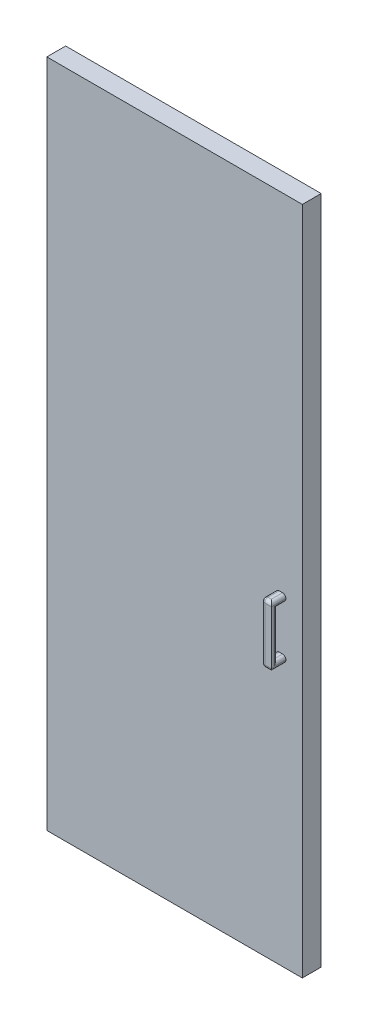
from build123d import *

# Parameters (mm, degrees)
BOSS_EXTRUDE2_DEPTH = 57.15
BOSS_EXTRUDE3_DEPTH = 44
CUT_EXTRUDE1_DEPTH  = 44
FILLET1_R           = 10
SKETCH6_W           = 120
SKETCH6_H           = 460.0000000000001
BOSS_EXTRUDE4_DEPTH = 10


with BuildPart() as part:
    # Sketch1 → Boss-Extrude2 (new body)
    with BuildSketch(Plane.XY):
        Polygon((0, 0), (0, 446.2018372120283), (-775, 446.2018372120282), (-774.9999999999995, -1585.7981627879717), (0, -1585.7981627879717), align=None)
    extrude(amount=BOSS_EXTRUDE2_DEPTH)

    # Sketch4 → Boss-Extrude3 (add)
    with BuildSketch(Plane.XY.offset(57.15)):
        Polygon((-79.99999999999993, -603.7981627879718), (-49.999999999999936, -603.7981627879718), (-49.999999999999915, -785.7981627879718), (-79.9999999999999, -785.7981627879718), align=None)
    extrude(amount=BOSS_EXTRUDE3_DEPTH)

    # Sketch5 → Cut-Extrude1 (cut)
    with BuildSketch(Plane.ZY.offset(80.00000000000003)):
        Polygon((83.14999999999999, -624.7981627879717), (57.150000000000006, -624.7981627879717), (57.15, -764.7981627879717), (83.15, -764.7981627879717), align=None)
    extrude(amount=-CUT_EXTRUDE1_DEPTH, mode=Mode.SUBTRACT)

    # Fillet1
    # the kernel refuses this fillet: 10 mm, written as the material it takes off along each edge
    with BuildSketch(Plane(origin=(-69.99999999999993, -613.7981627879718, 91.15), x_dir=(-1, -1.6e-16, 0), z_dir=(0, 1, 0))) as fillet1_piece_1_section:
        Polygon((0, 0), (FILLET1_R, 0), (FILLET1_R, FILLET1_R), (0, FILLET1_R), align=None)
    fillet1_piece_1 = extrude(amount=FILLET1_R, mode=Mode.PRIVATE)
    fillet1_piece_1 = fillet1_piece_1 - Plane(origin=(-69.99999999999993, -613.7981627879718, 91.15), x_dir=(0.7071067811865475, 0, -0.7071067811865475), z_dir=(0, 1, 0)) * Sphere(FILLET1_R, mode=Mode.PRIVATE)
    add(fillet1_piece_1, mode=Mode.SUBTRACT)
    with BuildSketch(Plane(origin=(-69.9999999999999, -775.7981627879718, 91.15), x_dir=(0, 0, 1), z_dir=(-1, -1.6e-16, 0))) as fillet1_piece_2_section:
        Polygon((0, 0), (FILLET1_R, 0), (FILLET1_R, -FILLET1_R), (0, -FILLET1_R), align=None)
    fillet1_piece_2 = extrude(amount=FILLET1_R, mode=Mode.PRIVATE)
    fillet1_piece_2 = fillet1_piece_2 - Plane(origin=(-69.9999999999999, -775.7981627879718, 91.15), x_dir=(0, 0.7071067811865475, -0.7071067811865475), z_dir=(-1, -1.6e-16, 0)) * Sphere(FILLET1_R, mode=Mode.PRIVATE)
    add(fillet1_piece_2, mode=Mode.SUBTRACT)
    with BuildSketch(Plane(origin=(-49.999999999999915, -785.7981627879718, 57.15), x_dir=(-1, 0, 0), z_dir=(0, 0, 1))) as fillet1_piece_3:
        with BuildLine():
            CenterArc((FILLET1_R, -FILLET1_R), FILLET1_R, 90, 90)
            Line((0, -FILLET1_R), (0, 0))
            Line((0, 0), (FILLET1_R, 0))
        make_face()
    extrude(amount=69, mode=Mode.SUBTRACT)
    with BuildSketch(Plane(origin=(-49.999999999999936, -603.7981627879718, 57.15), x_dir=(0, -1, 0), z_dir=(0, 0, 1))) as fillet1_piece_4:
        with BuildLine():
            CenterArc((FILLET1_R, -FILLET1_R), FILLET1_R, 90, 90)
            Line((0, -FILLET1_R), (0, 0))
            Line((0, 0), (FILLET1_R, 0))
        make_face()
    extrude(amount=69, mode=Mode.SUBTRACT)
    with BuildSketch(Plane(origin=(-79.99999999999993, -603.7981627879718, 57.15), x_dir=(1, 0, 0), z_dir=(0, 0, 1))) as fillet1_piece_5:
        with BuildLine():
            CenterArc((FILLET1_R, -FILLET1_R), FILLET1_R, 90, 90)
            Line((0, -FILLET1_R), (0, 0))
            Line((0, 0), (FILLET1_R, 0))
        make_face()
    extrude(amount=34.00000000000001, mode=Mode.SUBTRACT)
    with BuildSketch(Plane(origin=(-79.9999999999999, -785.7981627879718, 57.15), x_dir=(1, 0, 0), z_dir=(0, 0, 1))) as fillet1_piece_6:
        with BuildLine():
            CenterArc((FILLET1_R, FILLET1_R), FILLET1_R, 180, 90)
            Line((0, FILLET1_R), (0, 0))
            Line((0, 0), (FILLET1_R, 0))
        make_face()
    extrude(amount=34.00000000000001, mode=Mode.SUBTRACT)
    with BuildSketch(Plane(origin=(-69.99999999999993, -603.7981627879718, 101.15), x_dir=(0, 0, -1), z_dir=(1, 0, 0))) as fillet1_piece_7:
        with BuildLine():
            CenterArc((FILLET1_R, -FILLET1_R), FILLET1_R, 90, 90)
            Line((0, -FILLET1_R), (0, 0))
            Line((0, 0), (FILLET1_R, 0))
        make_face()
    extrude(amount=44.99999999999999, mode=Mode.SUBTRACT)
    with BuildSketch(Plane(origin=(-79.9999999999999, -775.7981627879718, 101.15), x_dir=(0, 0, -1), z_dir=(-1.6e-16, 1, 0))) as fillet1_piece_8:
        with BuildLine():
            CenterArc((FILLET1_R, -FILLET1_R), FILLET1_R, 90, 90)
            Line((0, -FILLET1_R), (0, 0))
            Line((0, 0), (FILLET1_R, 0))
        make_face()
    extrude(amount=162, mode=Mode.SUBTRACT)
    with BuildSketch(Plane(origin=(-24.999999999999915, -785.7981627879718, 101.15), x_dir=(0, 0, -1), z_dir=(-1, 0, 0))) as fillet1_piece_9:
        with BuildLine():
            CenterArc((FILLET1_R, -FILLET1_R), FILLET1_R, 90, 90)
            Line((0, -FILLET1_R), (0, 0))
            Line((0, 0), (FILLET1_R, 0))
        make_face()
    extrude(amount=44.999999999999986, mode=Mode.SUBTRACT)
    with BuildSketch(Plane(origin=(-79.99999999999991, -764.7981627879717, 57.15000000000002), x_dir=(1.42e-15, -1, 0), z_dir=(0, 0, 1))) as fillet1_piece_10:
        with BuildLine():
            CenterArc((FILLET1_R, FILLET1_R), FILLET1_R, 180, 89.99999999999989)
            Line((1.421e-14, FILLET1_R), (0, 0))
            Line((0, 0), (FILLET1_R, 0))
        make_face()
    extrude(amount=25.999999999999986, mode=Mode.SUBTRACT)
    with BuildSketch(Plane(origin=(-79.99999999999993, -624.7981627879717, 83.14999999999999), x_dir=(0, 1, 0), z_dir=(0, 0, -1))) as fillet1_piece_11:
        with BuildLine():
            CenterArc((FILLET1_R, FILLET1_R), FILLET1_R, 180, 90)
            Line((0, FILLET1_R), (0, 0))
            Line((0, 0), (FILLET1_R, 0))
        make_face()
    extrude(amount=25.999999999999986, mode=Mode.SUBTRACT)
    with BuildSketch(Plane(origin=(-79.99999999999991, -764.7981627879717, 83.15), x_dir=(1.42e-15, 1e-16, 1), z_dir=(-1.5e-16, 1, -1e-16))) as fillet1_piece_12:
        with BuildLine():
            CenterArc((FILLET1_R, FILLET1_R), FILLET1_R, 180, 89.99999999999989)
            Line((1.421e-14, FILLET1_R), (0, 0))
            Line((0, 0), (FILLET1_R, 0))
        make_face()
    extrude(amount=140, mode=Mode.SUBTRACT)
    with BuildSketch(Plane(origin=(-49.999999999999915, -764.7981627879717, 83.15), x_dir=(0, -1, 0), z_dir=(0, 0, -1))) as fillet1_piece_13:
        with BuildLine():
            CenterArc((FILLET1_R, FILLET1_R), FILLET1_R, 180, 90)
            Line((0, FILLET1_R), (0, 0))
            Line((0, 0), (FILLET1_R, 0))
        make_face()
    extrude(amount=26, mode=Mode.SUBTRACT)
    with BuildSketch(Plane(origin=(-49.999999999999936, -624.7981627879717, 57.150000000000006), x_dir=(0, 1, 0), z_dir=(0, 0, 1))) as fillet1_piece_14:
        with BuildLine():
            CenterArc((FILLET1_R, FILLET1_R), FILLET1_R, 180.00000000000003, 90)
            Line((0, FILLET1_R), (0, 0))
            Line((0, 0), (FILLET1_R, 0))
        make_face()
    extrude(amount=25.999999999999986, mode=Mode.SUBTRACT)
    with BuildSketch(Plane(origin=(-49.999999999999936, -624.7981627879717, 83.15), x_dir=(0, 1e-16, 1), z_dir=(1.2e-16, -1, 1e-16))) as fillet1_piece_15:
        with BuildLine():
            CenterArc((FILLET1_R, FILLET1_R), FILLET1_R, 180, 90)
            Line((0, FILLET1_R), (0, 0))
            Line((0, 0), (FILLET1_R, 0))
        make_face()
    extrude(amount=140, mode=Mode.SUBTRACT)
    with BuildSketch(Plane(origin=(-79.99999999999991, -764.7981627879717, 57.15000000000002), x_dir=(1.42e-15, -1, 0), z_dir=(0, 0, 1))) as fillet1_piece_16a_section:
        with BuildLine():
            CenterArc((FILLET1_R, FILLET1_R), FILLET1_R, 180, 89.99999999999989)
            Line((1.421e-14, FILLET1_R), (0, 0))
            Line((0, 0), (FILLET1_R, 0))
        make_face()
    fillet1_piece_16a = extrude(amount=50.999999999999986, mode=Mode.PRIVATE)
    fillet1_piece_16a = split(fillet1_piece_16a, bisect_by=Plane(origin=(-77.7360488573316, -767.0621139306398, 83.15), z_dir=(0, 1e-16, 1)), keep=Keep.TOP, mode=Mode.PRIVATE)
    with BuildSketch(Plane(origin=(-79.9999999999999, -789.7981627879717, 83.15), x_dir=(0, 1e-16, 1), z_dir=(-1.5e-16, 1, -1e-16))) as fillet1_piece_16b_section:
        with BuildLine():
            CenterArc((FILLET1_R, FILLET1_R), FILLET1_R, 180, 90)
            Line((0, FILLET1_R), (0, 0))
            Line((0, 0), (FILLET1_R, 0))
        make_face()
    fillet1_piece_16b = extrude(amount=165, mode=Mode.PRIVATE)
    fillet1_piece_16b = split(fillet1_piece_16b, bisect_by=Plane(origin=(-77.73604885733165, -764.7981627879717, 85.41395114266827), z_dir=(1.5e-16, -1, 0)), keep=Keep.TOP, mode=Mode.PRIVATE)
    fillet1_piece_16 = fillet1_piece_16a & fillet1_piece_16b
    add(fillet1_piece_16, mode=Mode.SUBTRACT)
    with BuildSketch(Plane(origin=(-79.99999999999991, -764.7981627879717, 83.15), x_dir=(1.42e-15, 1e-16, 1), z_dir=(-1.5e-16, 1, -1e-16))) as fillet1_piece_17a_section:
        with BuildLine():
            CenterArc((FILLET1_R, FILLET1_R), FILLET1_R, 180, 89.99999999999989)
            Line((1.421e-14, FILLET1_R), (0, 0))
            Line((0, 0), (FILLET1_R, 0))
        make_face()
    fillet1_piece_17a = extrude(amount=165, mode=Mode.PRIVATE)
    fillet1_piece_17a = split(fillet1_piece_17a, bisect_by=Plane(origin=(-77.73604885733167, -624.7981627879717, 85.41395114266825), z_dir=(-1.5e-16, 1, 0)), keep=Keep.TOP, mode=Mode.PRIVATE)
    with BuildSketch(Plane(origin=(-79.99999999999993, -624.7981627879717, 108.14999999999998), x_dir=(0, 1, 0), z_dir=(0, 0, -1))) as fillet1_piece_17b_section:
        with BuildLine():
            CenterArc((FILLET1_R, FILLET1_R), FILLET1_R, 180, 90)
            Line((0, FILLET1_R), (0, 0))
            Line((0, 0), (FILLET1_R, 0))
        make_face()
    fillet1_piece_17b = extrude(amount=50.999999999999986, mode=Mode.PRIVATE)
    fillet1_piece_17b = split(fillet1_piece_17b, bisect_by=Plane(origin=(-77.73604885733164, -622.5342116453035, 83.14999999999999), z_dir=(0, 1e-16, 1)), keep=Keep.TOP, mode=Mode.PRIVATE)
    fillet1_piece_17 = fillet1_piece_17a & fillet1_piece_17b
    add(fillet1_piece_17, mode=Mode.SUBTRACT)
    with BuildSketch(Plane(origin=(-49.999999999999936, -624.7981627879717, 83.15), x_dir=(0, 1e-16, 1), z_dir=(1.2e-16, -1, 1e-16))) as fillet1_piece_18a_section:
        with BuildLine():
            CenterArc((FILLET1_R, FILLET1_R), FILLET1_R, 180, 90)
            Line((0, FILLET1_R), (0, 0))
            Line((0, 0), (FILLET1_R, 0))
        make_face()
    fillet1_piece_18a = extrude(amount=165, mode=Mode.PRIVATE)
    fillet1_piece_18a = split(fillet1_piece_18a, bisect_by=Plane(origin=(-52.26395114266817, -764.7981627879717, 85.41395114266827), z_dir=(1.5e-16, -1, 0)), keep=Keep.TOP, mode=Mode.PRIVATE)
    with BuildSketch(Plane(origin=(-49.999999999999915, -764.7981627879717, 108.15), x_dir=(0, -1, 0), z_dir=(0, 0, -1))) as fillet1_piece_18b_section:
        with BuildLine():
            CenterArc((FILLET1_R, FILLET1_R), FILLET1_R, 180, 90)
            Line((0, FILLET1_R), (0, 0))
            Line((0, 0), (FILLET1_R, 0))
        make_face()
    fillet1_piece_18b = extrude(amount=51, mode=Mode.PRIVATE)
    fillet1_piece_18b = split(fillet1_piece_18b, bisect_by=Plane(origin=(-52.2639511426682, -767.0621139306397, 83.15), z_dir=(0, 1e-16, 1)), keep=Keep.TOP, mode=Mode.PRIVATE)
    fillet1_piece_18 = fillet1_piece_18a & fillet1_piece_18b
    add(fillet1_piece_18, mode=Mode.SUBTRACT)
    with BuildSketch(Plane(origin=(-49.999999999999936, -624.7981627879717, 57.150000000000006), x_dir=(0, 1, 0), z_dir=(0, 0, 1))) as fillet1_piece_19a_section:
        with BuildLine():
            CenterArc((FILLET1_R, FILLET1_R), FILLET1_R, 180.00000000000003, 90)
            Line((0, FILLET1_R), (0, 0))
            Line((0, 0), (FILLET1_R, 0))
        make_face()
    fillet1_piece_19a = extrude(amount=50.999999999999986, mode=Mode.PRIVATE)
    fillet1_piece_19a = split(fillet1_piece_19a, bisect_by=Plane(origin=(-52.26395114266823, -622.5342116453035, 83.14999999999999), z_dir=(0, 1e-16, 1)), keep=Keep.TOP, mode=Mode.PRIVATE)
    with BuildSketch(Plane(origin=(-49.999999999999936, -599.7981627879717, 83.14999999999999), x_dir=(0, 1e-16, 1), z_dir=(1.2e-16, -1, 1e-16))) as fillet1_piece_19b_section:
        with BuildLine():
            CenterArc((FILLET1_R, FILLET1_R), FILLET1_R, 179.99999999999997, 90)
            Line((0, FILLET1_R), (0, 0))
            Line((0, 0), (FILLET1_R, 0))
        make_face()
    fillet1_piece_19b = extrude(amount=165, mode=Mode.PRIVATE)
    fillet1_piece_19b = split(fillet1_piece_19b, bisect_by=Plane(origin=(-52.26395114266818, -624.7981627879717, 85.41395114266824), z_dir=(-1.5e-16, 1, 0)), keep=Keep.TOP, mode=Mode.PRIVATE)
    fillet1_piece_19 = fillet1_piece_19a & fillet1_piece_19b
    add(fillet1_piece_19, mode=Mode.SUBTRACT)

    # Sketch6 → Boss-Extrude4 (add)
    with BuildSketch(Plane(origin=(0, 0, 0), x_dir=(-1, 0, 0), z_dir=(0, 0, -1))):
        with Locations((85, -694.7981627879719)):
            Rectangle(SKETCH6_W, SKETCH6_H)
    extrude(amount=BOSS_EXTRUDE4_DEPTH)


solid = part.part
